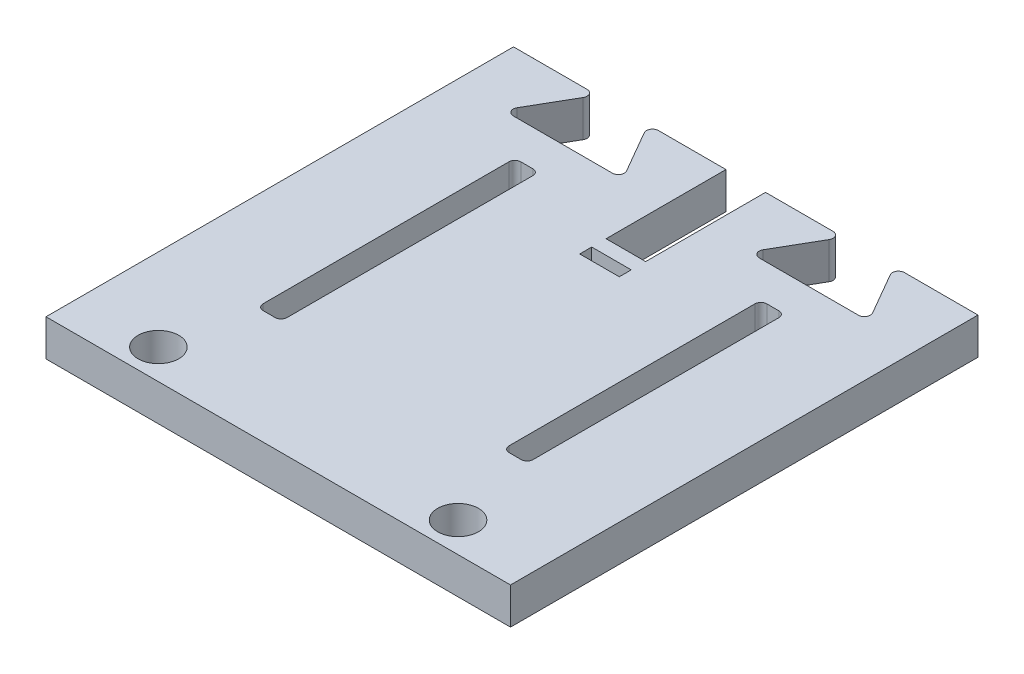
from build123d import *

# Parameters (mm, degrees)
BOSS_EXTRUDE1_DEPTH                = 3.05
FILLET3_R                          = 0.5
SKETCH2_W                          = 3.3
SKETCH2_H                          = 47
SKETCH2_H_2                        = 1
CUT_EXTRUDE1_DEPTH                 = 44.654245212
SKETCH6_W                          = 2
SKETCH6_H                          = 21.5
CUT_EXTRUDE2_DEPTH                 = 44.654245212
FILLET4_R                          = 0.5
M3_CLEARANCE_HEAD_MOUNTING_HOLES_D = 3.4


with BuildPart() as part:
    # Sketch1 → Boss-Extrude1 (new body)
    with BuildSketch(Plane(origin=(0, 0, 0), x_dir=(1, 0, 0), z_dir=(0, 1, 0))):
        Polygon((-19.375, 0), (-19.375, 39), (-12.375, 39), (-15.261751346, 34), (-5.261751346, 34), (-8.148502692, 39), (8.148502692, 39), (5.261751346, 34), (15.261751346, 34), (12.375, 39), (19.375, 39), (19.375, 0), align=None)
    extrude(amount=BOSS_EXTRUDE1_DEPTH)

    # Fillet3
    fillet3_edges = [part.edges().sort_by_distance(p)[0] for p in [
        (15.261751346, 1.525, -34),
        (12.375, 1.525, -39),
        (5.261751346, 1.525, -34),
        (8.148502692, 1.525, -39),
        (-8.148502692, 1.525, -39),
        (-5.261751346, 1.525, -34),
        (-15.261751346, 1.525, -34),
        (-12.375, 1.525, -39),
    ]]
    fillet(fillet3_edges, radius=FILLET3_R)

    # Sketch2 → Cut-Extrude1 (cut, through all)
    with BuildSketch(Plane(origin=(0, 3.05, 0), x_dir=(1, 0, 0), z_dir=(0, 1, 0))):
        with Locations((0, 52.5)):
            Rectangle(SKETCH2_W, SKETCH2_H)
        with Locations((0, 27.3)):
            Rectangle(SKETCH2_W, SKETCH2_H_2)
    extrude(amount=-CUT_EXTRUDE1_DEPTH, mode=Mode.SUBTRACT)

    # Sketch6 → Cut-Extrude2 (cut, through all)
    with BuildSketch(Plane(origin=(0, 3.05, 0), x_dir=(1, 0, 0), z_dir=(0, 1, 0))):
        with Locations((-10.261751346, 20.25)):
            Rectangle(SKETCH6_W, SKETCH6_H)
        with Locations((10.261751346, 20.25)):
            Rectangle(SKETCH6_W, SKETCH6_H)
    extrude(amount=-CUT_EXTRUDE2_DEPTH, mode=Mode.SUBTRACT)

    # Fillet4
    fillet4_edges = [part.edges().sort_by_distance(p)[0] for p in [
        (9.261751346, 1.525, -9.5),
        (11.261751346, 1.525, -9.5),
        (11.261751346, 1.525, -31),
        (9.261751346, 1.525, -31),
        (-11.261751346, 1.525, -9.5),
        (-9.261751346, 1.525, -9.5),
        (-9.261751346, 1.525, -31),
        (-11.261751346, 1.525, -31),
    ]]
    fillet(fillet4_edges, radius=FILLET4_R)

    # M3 Clearance Head Mounting Holes (through all)
    with Locations(Plane(origin=(0, 3.05, 0), x_dir=(1, 0, 0), z_dir=(0, 1, 0))):
        with Locations((-12.5, 2.5), (12.5, 2.5)):
            Hole(M3_CLEARANCE_HEAD_MOUNTING_HOLES_D / 2)


solid = part.part
